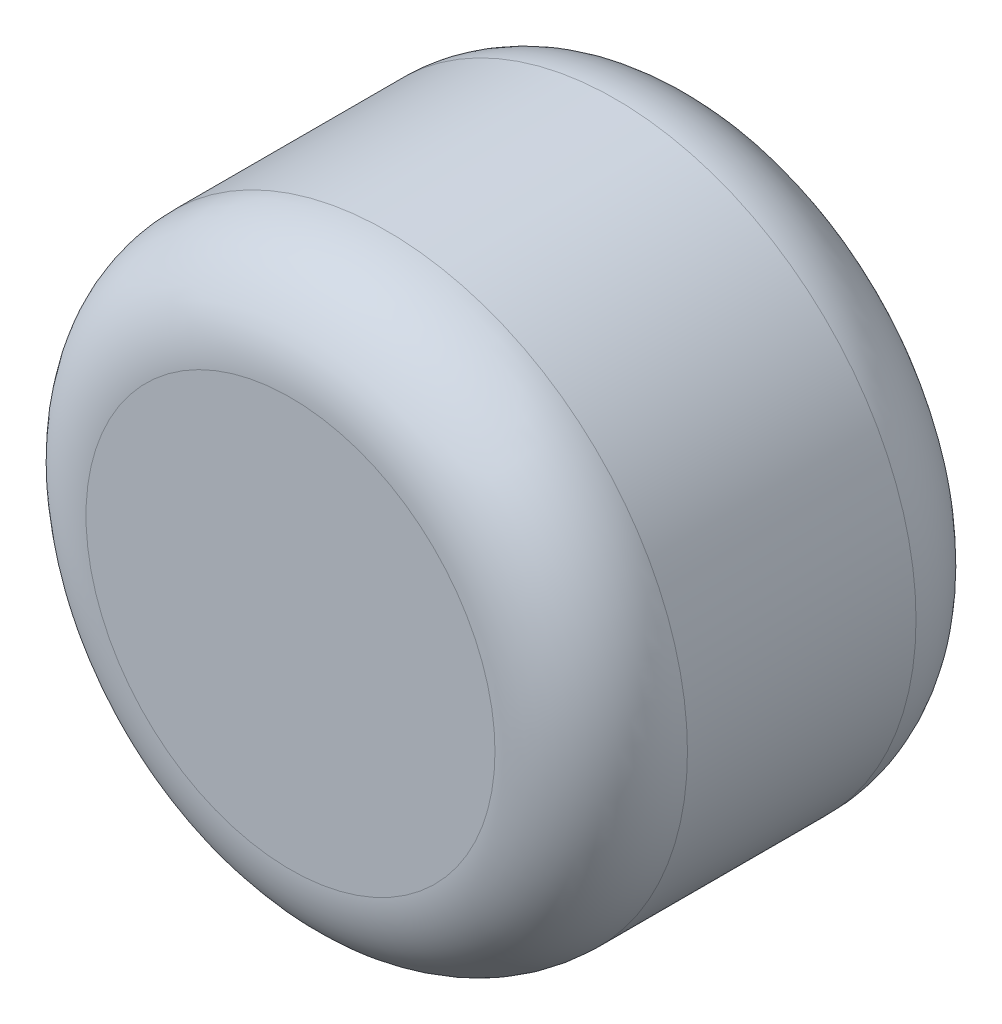
from build123d import *

# Parameters (mm, degrees)
SKETCH1_R           = 63.5
BOSS_EXTRUDE1_DEPTH = 44.45
FILLET1_R           = 20.32


with BuildPart() as part:
    # Sketch1 → Boss-Extrude1 (new, symmetric)
    with BuildSketch(Plane.XY):
        Circle(SKETCH1_R)
    extrude(amount=BOSS_EXTRUDE1_DEPTH, both=True)

    # Fillet1
    fillet1_edges = [part.edges().sort_by_distance(p)[0] for p in [
        (-63.5, 0, -44.45),
        (-63.5, 0, 44.45),
    ]]
    fillet(fillet1_edges, radius=FILLET1_R)


solid = part.part
